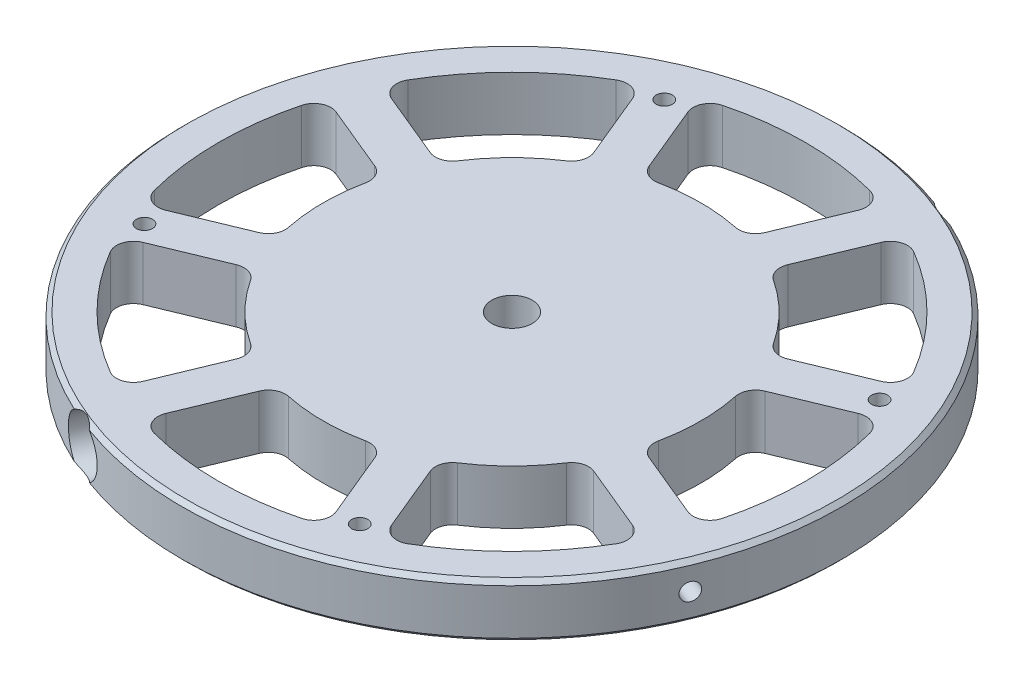
from build123d import *

# Parameters (mm, degrees)
SKETCH2_W                = 77.55
SKETCH2_H                = 12.7
F_10_24_TAPPED_HOLE2_D   = 3.7973
CIRPATTERN3_COUNT        = 4
CUT_EXTRUDE1_DEPTH       = 111.405140279
FILLET1_R                = 4
CIRPATTERN4_COUNT        = 8
FILLET1_OF_CIRPATTERN4_R = 4
CHAMFER1_SIZE            = 1
SKETCH15_W               = 2.0447
SKETCH15_H               = 101.323957926
SKETCH19_R               = 6.25
CUT_EXTRUDE3_DEPTH       = 5
CIRPATTERN5_COUNT        = 2
CIRPATTERN6_COUNT        = 2
SKETCH22_R               = 4.765
CUT_EXTRUDE4_DEPTH       = 12.8


with BuildPart() as part:
    # Sketch2 → Revolve1 (revolve)
    with BuildSketch(Plane(origin=(0, 0, 0), x_dir=(0, 0, -1), z_dir=(1, 0, 0))):
        with Locations((-38.775, 6.35)):
            Rectangle(SKETCH2_W, SKETCH2_H)
    revolve(axis=Axis((0, -0.888756804, 0), (0, 1, 0)))

    # #10-24 Tapped Hole2 (through all)
    with Locations(Plane(origin=(0, 12.7, 0), x_dir=(1, 0, 0), z_dir=(0, 1, 0))):
        with Locations((-25.333643223, 61.160825052)):
            f_10_24_tapped_hole2 = Hole(F_10_24_TAPPED_HOLE2_D / 2)

    # CirPattern3: #10-24 Tapped Hole2 ×4 about axis
    cirpattern3_axis = Axis((0, -0.888756804, 0), (0, 1, 0))
    for i in range(1, CIRPATTERN3_COUNT):
        add(f_10_24_tapped_hole2.rotate(cirpattern3_axis, i * 360 / CIRPATTERN3_COUNT), mode=Mode.SUBTRACT)

    # Sketch8 → Cut-Extrude1 (cut, through all)
    with BuildSketch(Plane(origin=(0, 12.7, 0), x_dir=(1, 0, 0), z_dir=(0, 1, 0))):
        with BuildLine():
            Line((-12.282922052, 42.719226653), (-21.735525784, 65.539830782))
            ThreePointArc((-21.735525784, 65.539830782), (0, 69.05), (21.735525784, 65.539830782))
            Line((21.735525784, 65.539830782), (12.282922052, 42.719226653))
            ThreePointArc((12.282922052, 42.719226653), (0, 44.45), (-12.282922052, 42.719226653))
        make_face()
    cut_extrude1 = extrude(amount=-CUT_EXTRUDE1_DEPTH, mode=Mode.SUBTRACT)

    # Fillet1
    fillet1_edges = [part.edges().sort_by_distance(p)[0] for p in [
        (12.282922052, 6.35, -42.719226653),
        (21.735525784, 6.35, -65.539830782),
        (-12.282922052, 6.35, -42.719226653),
        (-21.735525784, 6.35, -65.539830782),
    ]]
    fillet(fillet1_edges, radius=FILLET1_R)

    # CirPattern4: Cut-Extrude1 ×8 about axis
    cirpattern4_axis = Axis((0, -0.888756804, 0), (0, 1, 0))
    for i in range(1, CIRPATTERN4_COUNT):
        add(cut_extrude1.rotate(cirpattern4_axis, i * 360 / CIRPATTERN4_COUNT), mode=Mode.SUBTRACT)

    # Fillet1 of CirPattern4
    fillet1_of_cirpattern4_edges = [part.edges().sort_by_distance(p)[0] for p in [
        (-21.521717378, 6.35, -38.89239233),
        (-30.974321109, 6.35, -61.712996458),
        (-38.89239233, 6.35, -21.521717378),
        (-61.712996458, 6.35, -30.974321109),
        (-42.719226653, 6.35, -12.282922052),
        (-65.539830782, 6.35, -21.735525784),
        (-42.719226653, 6.35, 12.282922052),
        (-65.539830782, 6.35, 21.735525784),
        (-38.89239233, 6.35, 21.521717378),
        (-61.712996458, 6.35, 30.974321109),
        (-21.521717378, 6.35, 38.89239233),
        (-30.974321109, 6.35, 61.712996458),
        (-12.282922052, 6.35, 42.719226653),
        (-21.735525784, 6.35, 65.539830782),
        (12.282922052, 6.35, 42.719226653),
        (21.735525784, 6.35, 65.539830782),
        (21.521717378, 6.35, 38.89239233),
        (30.974321109, 6.35, 61.712996458),
        (38.89239233, 6.35, 21.521717378),
        (61.712996458, 6.35, 30.974321109),
        (42.719226653, 6.35, 12.282922052),
        (65.539830782, 6.35, 21.735525784),
        (42.719226653, 6.35, -12.282922052),
        (65.539830782, 6.35, -21.735525784),
        (38.89239233, 6.35, -21.521717378),
        (61.712996458, 6.35, -30.974321109),
        (21.521717378, 6.35, -38.89239233),
        (30.974321109, 6.35, -61.712996458),
    ]]
    fillet(fillet1_of_cirpattern4_edges, radius=FILLET1_OF_CIRPATTERN4_R)

    # Chamfer1
    chamfer1_edges = [part.edges().sort_by_distance(p)[0] for p in [
        (0, 0, -77.55),
        (0, 12.7, -77.55),
    ]]
    chamfer(chamfer1_edges, length=CHAMFER1_SIZE)

    # Sketch15 → #20 (0.161) Diameter Hole1 (revolve, cut)
    with BuildSketch(Plane(origin=(0, 6.35, 0), x_dir=(-0.38268343236508734, 0, 0.9238795325112877), z_dir=(0, 1, 0))):
        with Locations((1.02235, 50.661978963)):
            Rectangle(SKETCH15_W, SKETCH15_H)
    revolve(axis=Axis((-5.866635031, 6.35, -2.430039796), (0.9238795325112877, 0, 0.3826834323650874)), mode=Mode.SUBTRACT)

    # Sketch19 → Cut-Extrude3 (cut)
    with BuildSketch(Plane(origin=(29.67710018, 0, -71.646857746), x_dir=(-0.9238795325112891, 0, -0.38268343236508423), z_dir=(0.38268343236508423, 0, -0.9238795325112891))):
        with Locations((0, 6.35)):
            Circle(SKETCH19_R)
    cut_extrude3 = extrude(amount=-CUT_EXTRUDE3_DEPTH, mode=Mode.SUBTRACT)

    # CirPattern5: Cut-Extrude3 ×2 about axis
    cirpattern5_axis = Axis((0, -0.888756804, 0), (0, 1, 0))
    for i in range(1, CIRPATTERN5_COUNT):
        add(cut_extrude3.rotate(cirpattern5_axis, i * 360 / CIRPATTERN5_COUNT), mode=Mode.SUBTRACT)

    # Sketch21 → #10-24 Tapped Hole1 (revolve, cut)
    with BuildSketch(Plane(origin=(-27.763683018, 6.35, 67.027460084), x_dir=(0.9238795325112891, 0, 0.38268343236508423), z_dir=(0, 1, 0))):
        Polygon((0, 0), (0, 51.940824014), (1.89865, 50.8), (1.89865, 0), align=None)
    f_10_24_tapped_hole1 = revolve(axis=Axis((-30.193722814, 6.35, 72.894095115), (0.38268343236508423, 0, -0.923879532511289)), mode=Mode.SUBTRACT)

    # CirPattern6: #10-24 Tapped Hole1 ×2 about axis
    cirpattern6_axis = Axis((0, -0.888756804, 0), (0, 1, 0))
    for i in range(1, CIRPATTERN6_COUNT):
        add(f_10_24_tapped_hole1.rotate(cirpattern6_axis, i * 360 / CIRPATTERN6_COUNT), mode=Mode.SUBTRACT)

    # Sketch22 → Cut-Extrude4 (cut)
    with BuildSketch(Plane(origin=(0, 12.7, 0), x_dir=(1, 0, 0), z_dir=(0, 1, 0))):
        Circle(SKETCH22_R)
    extrude(amount=-CUT_EXTRUDE4_DEPTH, mode=Mode.SUBTRACT)


solid = part.part
